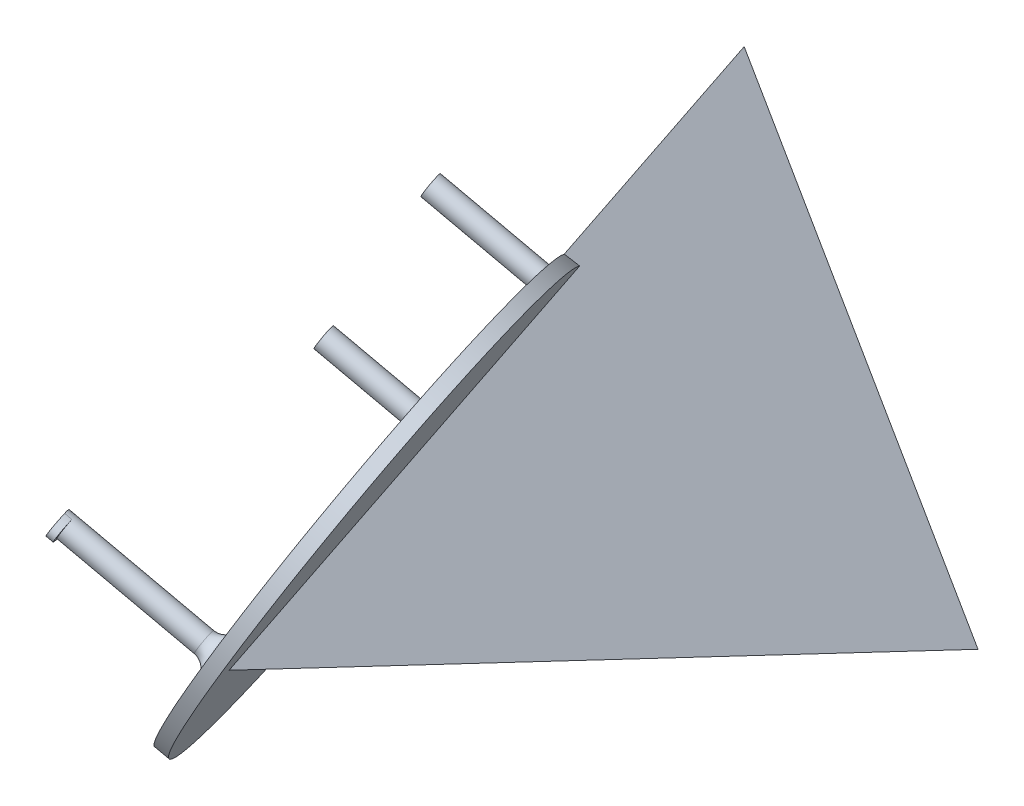
from build123d import *

# Parameters (mm, degrees)
AUFSATZ_LINEAR_AUSTRAGEN1_DEPTH = 40
FASE1_SIZE                      = 40
FASE1_SIZE_2                    = 9.973120114
WANDUNG1_T                      = -2
SKIZZE2_R                       = 17
AUFSATZ_LINEAR_AUSTRAGEN2_DEPTH = 1
SKIZZE3_R                       = 0.8
AUFSATZ_LINEAR_AUSTRAGEN3_DEPTH = 11
VERRUNDUNG1_R                   = 1
SKIZZE4_R                       = 0.8
AUFSATZ_LINEAR_AUSTRAGEN4_DEPTH = 8
AUFSATZ_LINEAR_START            = -0.5
AUFSATZ_LINEAR_AUSTRAGEN5_DEPTH = 0.5


with BuildPart() as part:
    # Skizze1 → Aufsatz-Linear austragen1 (new body)
    with BuildSketch(Plane.XY):
        Polygon((0, 30.310889132), (-17.5, 0), (17.5, 0), align=None)
    extrude(amount=AUFSATZ_LINEAR_AUSTRAGEN1_DEPTH)

    # Fase1
    # the kernel refuses this chamfer: 40, 9.973120114 mm, written as the material it takes off along each edge
    with BuildSketch(Plane(origin=(-121.385689972, 0, 40), x_dir=(0, -0.009314926653100153, -0.9999566151296001), z_dir=(1, 0, 0)), Plane(origin=(69.442844986, -89.967646606, 40), x_dir=(0.008066963115973384, 0.004657463326550014, -0.9999566151296001), z_dir=(-0.5, 0.8660254037844387, 0)), Plane(origin=(51.942844986, 120.278535738, 40), x_dir=(-0.008066963115973531, 0.0046574633265501, -0.9999566151296001), z_dir=(-0.5, -0.8660254037844387, 0))) as fase1_piece_1:
        Polygon((FASE1_SIZE * 0.99995661513, FASE1_SIZE * 0.0093149266531), (-FASE1_SIZE_2 * 0.00931492665285, FASE1_SIZE_2 * 0.999956615102), (0, 0), align=None)
    extrude(amount=242.771379945, mode=Mode.SUBTRACT)

    # Wandung1
    wandung1_openings = [part.faces().sort_by_distance(p)[0] for p in [
        (0, 10.103629711, 0),
    ]]
    offset(amount=WANDUNG1_T, openings=wandung1_openings, kind=Kind.INTERSECTION)

    # Skizze2 → Aufsatz-Linear austragen2 (add)
    with BuildSketch(Plane(origin=(-12.356843578, 7.134226966, 3.557525123), x_dir=(0.20951050732099702, -0.1209609477998327, 0.9702957262759971), z_dir=(-0.8403007481384855, 0.4851478631379986, 0.2419218955996654))):
        with Locations((22.558111296, 8.75)):
            Circle(SKIZZE2_R)
    extrude(amount=-AUFSATZ_LINEAR_AUSTRAGEN2_DEPTH)

    # Skizze3 → Aufsatz-Linear austragen3 (add)
    with BuildSketch(Plane(origin=(-12.356843578, 7.134226966, 3.557525123), x_dir=(0.20951050732099702, -0.1209609477998327, 0.9702957262759971), z_dir=(-0.8403007481384855, 0.4851478631379986, 0.2419218955996654))):
        with Locations(Location((36.558111296, 8.75, 0), (0, 0, 270))):
            Circle(SKIZZE3_R)
    extrude(amount=AUFSATZ_LINEAR_AUSTRAGEN3_DEPTH)

    # Verrundung1
    verrundung1_edges = [part.edges().sort_by_distance(p)[0] for p in [
        (0.077464866, 10.98266578, 39.029704274),
    ]]
    fillet(verrundung1_edges, radius=VERRUNDUNG1_R)

    # Skizze4 → Aufsatz-Linear austragen4 (add)
    with BuildSketch(Plane(origin=(-12.356843578, 7.134226966, 3.557525123), x_dir=(0.20951050732099705, -0.12096094779983271, 0.9702957262759971), z_dir=(-0.8403007481384855, 0.4851478631379987, 0.24192189559966543))):
        with Locations(Location((9.558111296, 16.75, 0), (0, 0, 270))):
            Circle(SKIZZE4_R)
        with Locations(Location((9.558111296, 0.75, 0), (0, 0, 270))):
            Circle(SKIZZE4_R)
    extrude(amount=AUFSATZ_LINEAR_AUSTRAGEN4_DEPTH)

    # Skizze5 → Aufsatz-Linear austragen5 (add)
    with BuildSketch(Plane(origin=(-21.600151808, 12.470853461, 6.218665974), x_dir=(0.209510507320997, -0.1209609477998327, 0.9702957262759971), z_dir=(-0.8403007481384855, 0.4851478631379987, 0.24192189559966537)).offset(AUFSATZ_LINEAR_START)):
        with BuildLine():
            ThreePointArc((36.558111296, 9.55), (35.758111296, 8.75), (36.558111296, 7.95))
            add(Edge.make_bspline(
                [(36.558111296, 7.95), (37.758111296, 7.95), (37.758111296, 8.75), (37.758111296, 9.55), (36.558111296, 9.55)],
                knots=[4.71238898, 4.71238898, 4.71238898, 6.283185307, 6.283185307, 7.853981634, 7.853981634, 7.853981634], degree=2, weights=[1, 0.707106781, 1, 0.707106781, 1]))
        make_face()
    extrude(amount=AUFSATZ_LINEAR_AUSTRAGEN5_DEPTH)


solid = part.part
